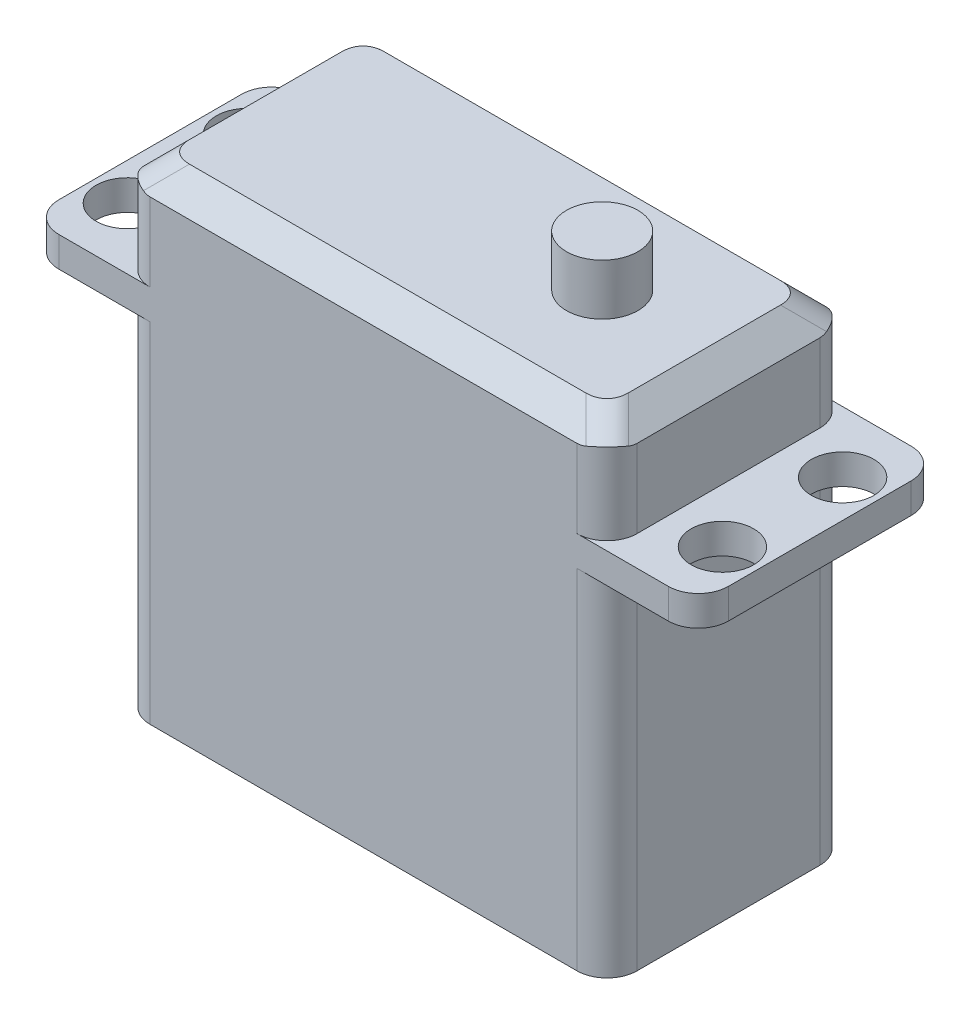
from build123d import *

# Parameters (mm, degrees)
BOSS_EXTRUDE1_DEPTH = 20.2
SKETCH2_R           = 2.975
BOSS_EXTRUDE2_DEPTH = 4.25
CUT_EXTRUDE1_START  = 29
SKETCH3_R           = 2.6
CUT_EXTRUDE1_DEPTH  = 4.25
CHAMFER1_SIZE       = 2
FILLET1_R           = 2.5


with BuildPart() as part:
    # Sketch1 → Boss-Extrude1 (new body)
    with BuildSketch(Plane.XY):
        Polygon((-20.25, 0), (20.25, 0), (20.25, 29), (27.85, 29), (27.85, 31.5), (20.25, 31.5), (20.25, 40), (-20.25, 40), (-20.25, 31.5), (-27.85, 31.5), (-27.85, 29), (-20.25, 29), align=None)
    extrude(amount=BOSS_EXTRUDE1_DEPTH)

    # Sketch2 → Boss-Extrude2 (add)
    with BuildSketch(Plane(origin=(0, 40, 0), x_dir=(1, 0, 0), z_dir=(0, 1, 0))):
        with Locations(Location((9.75, -10.1, 0), (0, 0, 90))):
            Circle(SKETCH2_R)
    extrude(amount=BOSS_EXTRUDE2_DEPTH)

    # Sketch3 → Cut-Extrude1 (cut)
    with BuildSketch(Plane(origin=(0, 0, 0), x_dir=(1, 0, 0), z_dir=(0, 1, 0)).offset(CUT_EXTRUDE1_START)):
        with Locations(Location((-24.75, -5.1, 0), (0, 0, 90))):
            Circle(SKETCH3_R)
        with Locations(Location((-24.75, -15.1, 0), (0, 0, 90))):
            Circle(SKETCH3_R)
    cut_extrude1 = extrude(amount=CUT_EXTRUDE1_DEPTH, mode=Mode.SUBTRACT)

    # Mirror1: Cut-Extrude1 across plane
    add(cut_extrude1.mirror(Plane(origin=(0, 0, 0), x_dir=(0, 0, 1), z_dir=(1, 0, 0))), mode=Mode.SUBTRACT)

    # Chamfer1
    chamfer1_edges = [part.edges().sort_by_distance(p)[0] for p in [
        (0, 40, 0),
        (0, 40, 20.2),
        (-20.25, 40, 10.1),
        (20.25, 40, 10.1),
    ]]
    chamfer(chamfer1_edges, length=CHAMFER1_SIZE)

    # Fillet1
    # the kernel refuses this fillet: 2.5 mm, written as the material it takes off along each edge
    with BuildSketch(Plane(origin=(20.25, -6.25, 0), x_dir=(-1, 0, 0), z_dir=(0, 1, 0)), Plane(origin=(-20.25, 29, 0), x_dir=(1, 0, 0), z_dir=(0, -1, 0)), Plane(origin=(-20.25, 29, 20.2), x_dir=(0, 0, -1), z_dir=(0, -1, 0)), Plane(origin=(20.25, -6.25, 20.2), x_dir=(0, 0, -1), z_dir=(0, 1, 0))) as fillet1_piece_1:
        with BuildLine():
            CenterArc((FILLET1_R, FILLET1_R), FILLET1_R, 180, 90)
            Line((0, FILLET1_R), (0, 0))
            Line((0, 0), (FILLET1_R, 0))
        make_face()
    extrude(amount=35.25, mode=Mode.SUBTRACT)
    with BuildSketch(Plane(origin=(20.25, -6.25, 0), x_dir=(-1, 0, 0), z_dir=(0, 1, 0))) as fillet1_piece_2_section:
        with BuildLine():
            CenterArc((FILLET1_R, FILLET1_R), FILLET1_R, 180, 90)
            Line((0, FILLET1_R), (0, 0))
            Line((0, 0), (FILLET1_R, 0))
        make_face()
    fillet1_piece_2 = extrude(amount=41.5, mode=Mode.PRIVATE)
    fillet1_piece_2 = split(fillet1_piece_2, bisect_by=Plane(origin=(19.684012214, 31.5, 0.565987786), z_dir=(0, 1, 0)), keep=Keep.TOP, mode=Mode.PRIVATE)
    add(fillet1_piece_2, mode=Mode.SUBTRACT)
    with BuildSketch(Plane(origin=(-20.25, 35.25, 0), x_dir=(1, 0, 0), z_dir=(0, -1, 0))) as fillet1_piece_3_section:
        with BuildLine():
            CenterArc((FILLET1_R, FILLET1_R), FILLET1_R, 180, 90)
            Line((0, FILLET1_R), (0, 0))
            Line((0, 0), (FILLET1_R, 0))
        make_face()
    fillet1_piece_3 = extrude(amount=41.5, mode=Mode.PRIVATE)
    fillet1_piece_3 = split(fillet1_piece_3, bisect_by=Plane(origin=(-19.684012214, 31.5, 0.565987786), z_dir=(0, 1, 0)), keep=Keep.TOP, mode=Mode.PRIVATE)
    add(fillet1_piece_3, mode=Mode.SUBTRACT)
    with BuildSketch(Plane(origin=(-27.85, 37.75, 0), x_dir=(1, 0, 0), z_dir=(0, -1, 0)), Plane(origin=(27.85, 22.75, 0), x_dir=(-1, 0, 0), z_dir=(0, 1, 0)), Plane(origin=(-27.85, 37.75, 20.2), x_dir=(0, 0, -1), z_dir=(0, -1, 0)), Plane(origin=(27.85, 22.75, 20.2), x_dir=(0, 0, -1), z_dir=(0, 1, 0))) as fillet1_piece_4:
        with BuildLine():
            CenterArc((FILLET1_R, FILLET1_R), FILLET1_R, 180, 90)
            Line((0, FILLET1_R), (0, 0))
            Line((0, 0), (FILLET1_R, 0))
        make_face()
    extrude(amount=15, mode=Mode.SUBTRACT)
    with BuildSketch(Plane(origin=(20.25, 25.25, 0), x_dir=(-1, 0, 0), z_dir=(0, 1, 0))) as fillet1_piece_5_section:
        with BuildLine():
            CenterArc((FILLET1_R, FILLET1_R), FILLET1_R, 180, 90)
            Line((0, FILLET1_R), (0, 0))
            Line((0, 0), (FILLET1_R, 0))
        make_face()
    fillet1_piece_5 = extrude(amount=19, mode=Mode.PRIVATE)
    fillet1_piece_5 = split(fillet1_piece_5, bisect_by=Plane(origin=(19.684012214, 29, 0.565987786), z_dir=(0, -1, 0)), keep=Keep.TOP, mode=Mode.PRIVATE)
    add(fillet1_piece_5, mode=Mode.SUBTRACT)
    with BuildSketch(Plane(origin=(20.25, 31.5, 0), x_dir=(-1, 0, 0), z_dir=(0, 1, 0)), Plane(origin=(20.25, 31.5, 20.2), x_dir=(0, 0, -1), z_dir=(0, 1, 0)), Plane(origin=(-20.25, 44.25, 20.2), x_dir=(0, 0, -1), z_dir=(0, -1, 0)), Plane(origin=(-20.25, 44.25, 0), x_dir=(1, 0, 0), z_dir=(0, -1, 0))) as fillet1_piece_6:
        with BuildLine():
            CenterArc((FILLET1_R, FILLET1_R), FILLET1_R, 180, 90)
            Line((0, FILLET1_R), (0, 0))
            Line((0, 0), (FILLET1_R, 0))
        make_face()
    extrude(amount=12.75, mode=Mode.SUBTRACT)
    with BuildSketch(Plane(origin=(20.25, 25.25, 20.2), x_dir=(0, 0, -1), z_dir=(0, 1, 0))) as fillet1_piece_7_section:
        with BuildLine():
            CenterArc((FILLET1_R, FILLET1_R), FILLET1_R, 180, 90)
            Line((0, FILLET1_R), (0, 0))
            Line((0, 0), (FILLET1_R, 0))
        make_face()
    fillet1_piece_7 = extrude(amount=19, mode=Mode.PRIVATE)
    fillet1_piece_7 = split(fillet1_piece_7, bisect_by=Plane(origin=(19.684012214, 29, 19.634012214), z_dir=(0, -1, 0)), keep=Keep.TOP, mode=Mode.PRIVATE)
    add(fillet1_piece_7, mode=Mode.SUBTRACT)
    with BuildSketch(Plane(origin=(-20.25, 35.25, 20.2), x_dir=(0, 0, -1), z_dir=(0, -1, 0))) as fillet1_piece_8_section:
        with BuildLine():
            CenterArc((FILLET1_R, FILLET1_R), FILLET1_R, 180, 90)
            Line((0, FILLET1_R), (0, 0))
            Line((0, 0), (FILLET1_R, 0))
        make_face()
    fillet1_piece_8 = extrude(amount=41.5, mode=Mode.PRIVATE)
    fillet1_piece_8 = split(fillet1_piece_8, bisect_by=Plane(origin=(-19.684012214, 31.5, 19.634012214), z_dir=(0, 1, 0)), keep=Keep.TOP, mode=Mode.PRIVATE)
    add(fillet1_piece_8, mode=Mode.SUBTRACT)
    with BuildSketch(Plane(origin=(20.25, -6.25, 20.2), x_dir=(0, 0, -1), z_dir=(0, 1, 0))) as fillet1_piece_9_section:
        with BuildLine():
            CenterArc((FILLET1_R, FILLET1_R), FILLET1_R, 180, 90)
            Line((0, FILLET1_R), (0, 0))
            Line((0, 0), (FILLET1_R, 0))
        make_face()
    fillet1_piece_9 = extrude(amount=41.5, mode=Mode.PRIVATE)
    fillet1_piece_9 = split(fillet1_piece_9, bisect_by=Plane(origin=(19.684012214, 31.5, 19.634012214), z_dir=(0, 1, 0)), keep=Keep.TOP, mode=Mode.PRIVATE)
    add(fillet1_piece_9, mode=Mode.SUBTRACT)
    with BuildSketch(Plane(origin=(-20.25, 44.25, 20.2), x_dir=(0, 0, -1), z_dir=(0, -1, 0))) as fillet1_piece_10_section:
        with BuildLine():
            CenterArc((FILLET1_R, FILLET1_R), FILLET1_R, 180, 90)
            Line((0, FILLET1_R), (0, 0))
            Line((0, 0), (FILLET1_R, 0))
        make_face()
    fillet1_piece_10 = extrude(amount=19, mode=Mode.PRIVATE)
    fillet1_piece_10 = split(fillet1_piece_10, bisect_by=Plane(origin=(-19.684012214, 29, 19.634012214), z_dir=(0, -1, 0)), keep=Keep.TOP, mode=Mode.PRIVATE)
    add(fillet1_piece_10, mode=Mode.SUBTRACT)
    with BuildSketch(Plane(origin=(-20.25, 44.25, 0), x_dir=(1, 0, 0), z_dir=(0, -1, 0))) as fillet1_piece_11_section:
        with BuildLine():
            CenterArc((FILLET1_R, FILLET1_R), FILLET1_R, 180, 90)
            Line((0, FILLET1_R), (0, 0))
            Line((0, 0), (FILLET1_R, 0))
        make_face()
    fillet1_piece_11 = extrude(amount=19, mode=Mode.PRIVATE)
    fillet1_piece_11 = split(fillet1_piece_11, bisect_by=Plane(origin=(-19.684012214, 29, 0.565987786), z_dir=(0, -1, 0)), keep=Keep.TOP, mode=Mode.PRIVATE)
    add(fillet1_piece_11, mode=Mode.SUBTRACT)
    with BuildSketch(Plane(origin=(22.333333333, 35.916666667, -2.083333333), x_dir=(-0.816496580927726, -0.4082482904638627, -0.4082482904638633), z_dir=(-0.5773502691896258, 0.5773502691896258, 0.5773502691896258)), Plane(origin=(22.333333333, 35.916666667, 22.283333333), x_dir=(0.40824829046386174, -0.4082482904638642, -0.8164965809277261), z_dir=(-0.5773502691896258, 0.5773502691896258, -0.5773502691896258))) as fillet1_piece_12:
        with BuildLine():
            CenterArc((FILLET1_R * 0.57735026919, FILLET1_R), FILLET1_R, 210, 60)
            Line((-FILLET1_R * 0.288675134595, FILLET1_R * 0.5), (0, 0))
            Line((0, 0), (FILLET1_R * 0.57735026919, 0))
        make_face()
    extrude(amount=10.68097998, mode=Mode.SUBTRACT)
    with BuildSketch(Plane(origin=(-22.333333333, 35.916666667, -2.083333333), x_dir=(0.8164965809277259, -0.4082482904638622, -0.40824829046386374), z_dir=(0.5773502691896258, 0.5773502691896258, 0.5773502691896258)), Plane(origin=(-22.333333333, 35.916666667, 22.283333333), x_dir=(-0.40824829046386424, -0.4082482904638618, -0.816496580927726), z_dir=(0.5773502691896258, 0.5773502691896258, -0.5773502691896258))) as fillet1_piece_13:
        with BuildLine():
            CenterArc((FILLET1_R * 0.57735026919, -FILLET1_R), FILLET1_R, 90, 60)
            Line((-FILLET1_R * 0.288675134595, -FILLET1_R * 0.5), (0, 0))
            Line((0, 0), (FILLET1_R * 0.57735026919, 0))
        make_face()
    extrude(amount=10.68097998, mode=Mode.SUBTRACT)


solid = part.part
